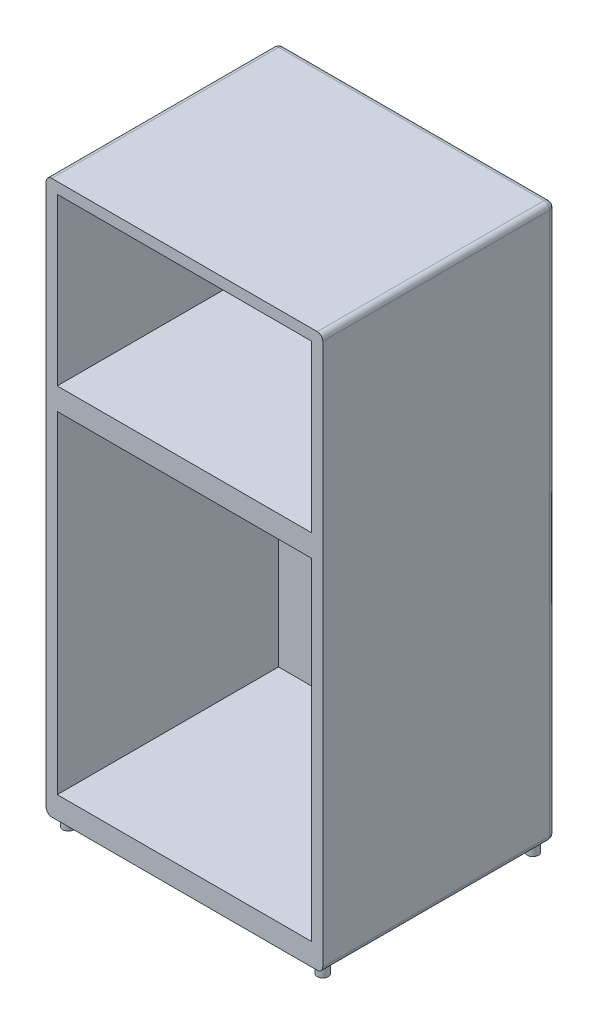
from build123d import *

# Parameters (mm, degrees)
SKETCH_1_W          = 25
SKETCH_1_H          = 50
EXTRUDE_1_DEPTH     = 21
SKETCH_2_W          = 23
SKETCH_2_H          = 15
SKETCH_2_H_2        = 30
CUT_EXTRUDE_1_DEPTH = 20
SKETCH_3_R          = 0.5
EXTRUDE_2_DEPTH     = 1
FILLET_1_R          = 0.5


with BuildPart() as part:
    # 草圖1 → 填料-伸長1 (new body)
    with BuildSketch(Plane.XY):
        Rectangle(SKETCH_1_W, SKETCH_1_H)
    extrude(amount=EXTRUDE_1_DEPTH)

    # 草圖2 → 除料-伸長1 (cut)
    with BuildSketch(Plane.XY.offset(21)):
        with Locations((0, 16.5)):
            Rectangle(SKETCH_2_W, SKETCH_2_H)
        with Locations((0, -8)):
            Rectangle(SKETCH_2_W, SKETCH_2_H_2)
    extrude(amount=-CUT_EXTRUDE_1_DEPTH, mode=Mode.SUBTRACT)

    # 草圖3 → 填料-伸長2 (add)
    with BuildSketch(Plane.XZ.offset(25)):
        with Locations(Location((-11.5, 20, 0), (0, 0, 90))):
            Circle(SKETCH_3_R)
        with Locations(Location((11.5, 20, 0), (0, 0, 90))):
            Circle(SKETCH_3_R)
        with Locations(Location((11.5, 1, 0), (0, 0, 90))):
            Circle(SKETCH_3_R)
        with Locations(Location((-11.5, 1, 0), (0, 0, 90))):
            Circle(SKETCH_3_R)
    extrude(amount=EXTRUDE_2_DEPTH)

    # 圓角1
    fillet_1_edges = [part.edges().sort_by_distance(p)[0] for p in [
        (0, -25, 0),
        (-12.5, 0, 0),
        (0, 25, 0),
        (12.5, 0, 0),
        (12.5, -25, 10.5),
        (-12.5, -25, 10.5),
        (-12.5, 25, 10.5),
        (12.5, 25, 10.5),
    ]]
    fillet(fillet_1_edges, radius=FILLET_1_R - 0.0001)  # a hair under: the kernel refuses the full size


solid = part.part
